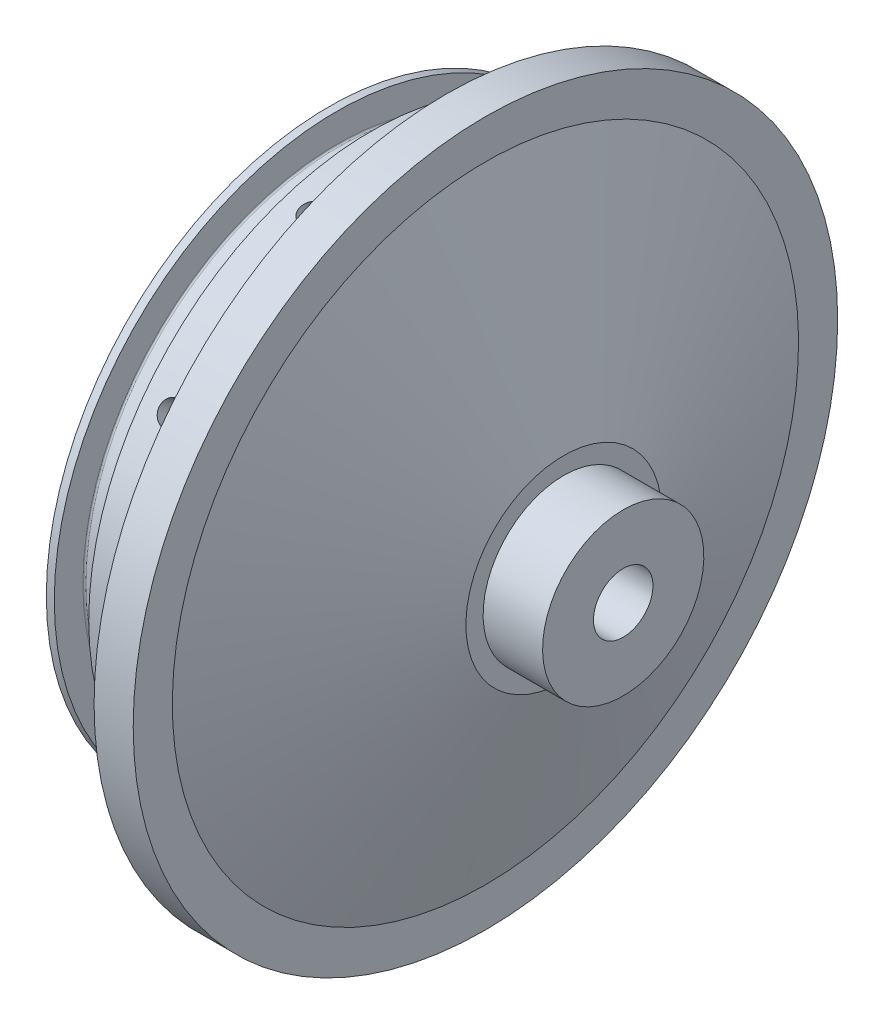
from build123d import *

# Parameters (mm, degrees)
SKETCH1_R           = 57.15
BOSS_EXTRUDE1_DEPTH = 6.35
SKETCH2_R           = 45.847
BOSS_EXTRUDE2_DEPTH = 19.05
SKETCH3_R           = 38.227
CUT_EXTRUDE1_DEPTH  = 6.604
SKETCH6_R           = 13.081
BOSS_EXTRUDE3_DEPTH = 9.652
SKETCH7_R           = 4.826
CUT_EXTRUDE2_DEPTH  = 94.87490881
FILLET1_R           = 2.032
SKETCH11_R          = 1.89865
CUT_EXTRUDE3_DEPTH  = 10.16
CIRPATTERN1_COUNT   = 10
SKETCH14_R          = 1.1303
CUT_EXTRUDE4_DEPTH  = 6.35
CIRPATTERN2_COUNT   = 8


with BuildPart() as part:
    # Sketch1 → Boss-Extrude1 (new body)
    with BuildSketch(Plane(origin=(0, 0, 0), x_dir=(0, 0, -1), z_dir=(1, 0, 0))):
        Circle(SKETCH1_R)
    extrude(amount=BOSS_EXTRUDE1_DEPTH)

    # Sketch2 → Boss-Extrude2 (add)
    with BuildSketch(Plane.ZY):
        Circle(SKETCH2_R)
    extrude(amount=BOSS_EXTRUDE2_DEPTH)

    # Sketch3 → Cut-Extrude1 (cut)
    with BuildSketch(Plane.ZY.offset(19.05)):
        Circle(SKETCH3_R)
    extrude(amount=-CUT_EXTRUDE1_DEPTH, mode=Mode.SUBTRACT)

    # Sketch5 → Revolve1 (revolve)
    with BuildSketch(Plane.XY):
        Polygon((6.35, -50.8), (19.05, -15.875), (19.05, 0), (6.35, 0), align=None)
    revolve(axis=Axis((6.35, 0, 0), (1, 0, 0)))

    # Sketch6 → Boss-Extrude3 (add)
    with BuildSketch(Plane(origin=(19.05, 0, 0), x_dir=(0, 0, -1), z_dir=(1, 0, 0))):
        Circle(SKETCH6_R)
    extrude(amount=BOSS_EXTRUDE3_DEPTH)

    # Sketch7 → Cut-Extrude2 (cut, through all)
    with BuildSketch(Plane(origin=(28.702, 0, 0), x_dir=(0, 0, -1), z_dir=(1, 0, 0))):
        Circle(SKETCH7_R)
    extrude(amount=-CUT_EXTRUDE2_DEPTH, mode=Mode.SUBTRACT)

    # Sketch8 → Cut-Revolve2 (revolve, cut)
    with BuildSketch(Plane.XY):
        Polygon((0, 0), (-12.446, 0), (-12.446, -29.21), (-2.794, -29.21), (10.414, -15.875), (10.414, 0), align=None)
    revolve(axis=Axis((10.414, 0, 0), (-1, 0, 0)), mode=Mode.SUBTRACT)

    # Fillet1
    fillet1_edges = [part.edges().sort_by_distance(p)[0] for p in [
        (-2.794, 29.21, 0),
        (10.414, 15.875, 0),
    ]]
    fillet(fillet1_edges, radius=FILLET1_R)

    # Sketch11 → Cut-Extrude3 (cut)
    with BuildSketch(Plane(origin=(0, 0, -45.847), x_dir=(-1, 0, 0), z_dir=(0, 0, -1))):
        with Locations((7.62, 0)):
            Circle(SKETCH11_R)
    cut_extrude3 = extrude(amount=-CUT_EXTRUDE3_DEPTH, mode=Mode.SUBTRACT)

    # CirPattern1: Cut-Extrude3 ×10 about axis
    cirpattern1_axis = Axis((0, 0, 0), (-1, 0, 0))
    for i in range(1, CIRPATTERN1_COUNT):
        add(cut_extrude3.rotate(cirpattern1_axis, i * 360 / CIRPATTERN1_COUNT), mode=Mode.SUBTRACT)

    # Sketch13 → Cut-Revolve3 (revolve, cut)
    with BuildSketch(Plane.XY):
        with BuildLine():
            Line((-17.757455489, 45.847), (-12.169455489, 45.847))
            Line((-12.169455489, 45.847), (-12.169455489, 41.2115))
            ThreePointArc((-12.169455489, 41.2115), (-12.243850367, 41.031894878), (-12.423455489, 40.9575))
            Line((-12.423455489, 40.9575), (-17.503455489, 40.9575))
            ThreePointArc((-17.503455489, 40.9575), (-17.683060611, 41.031894878), (-17.757455489, 41.2115))
            Line((-17.757455489, 41.2115), (-17.757455489, 45.847))
        make_face()
    revolve(axis=Axis((0, 0, 0), (-1, 0, 0)), mode=Mode.SUBTRACT)

    # Sketch14 → Cut-Extrude4 (cut)
    with BuildSketch(Plane.ZY.offset(12.446)):
        with Locations((0, 33.3375)):
            Circle(SKETCH14_R)
    cut_extrude4 = extrude(amount=-CUT_EXTRUDE4_DEPTH, mode=Mode.SUBTRACT)

    # CirPattern2: Cut-Extrude4 ×8 about axis
    cirpattern2_axis = Axis((-12.446, 0, 0), (1, 0, 0))
    for i in range(1, CIRPATTERN2_COUNT):
        add(cut_extrude4.rotate(cirpattern2_axis, i * 360 / CIRPATTERN2_COUNT), mode=Mode.SUBTRACT)


solid = part.part
